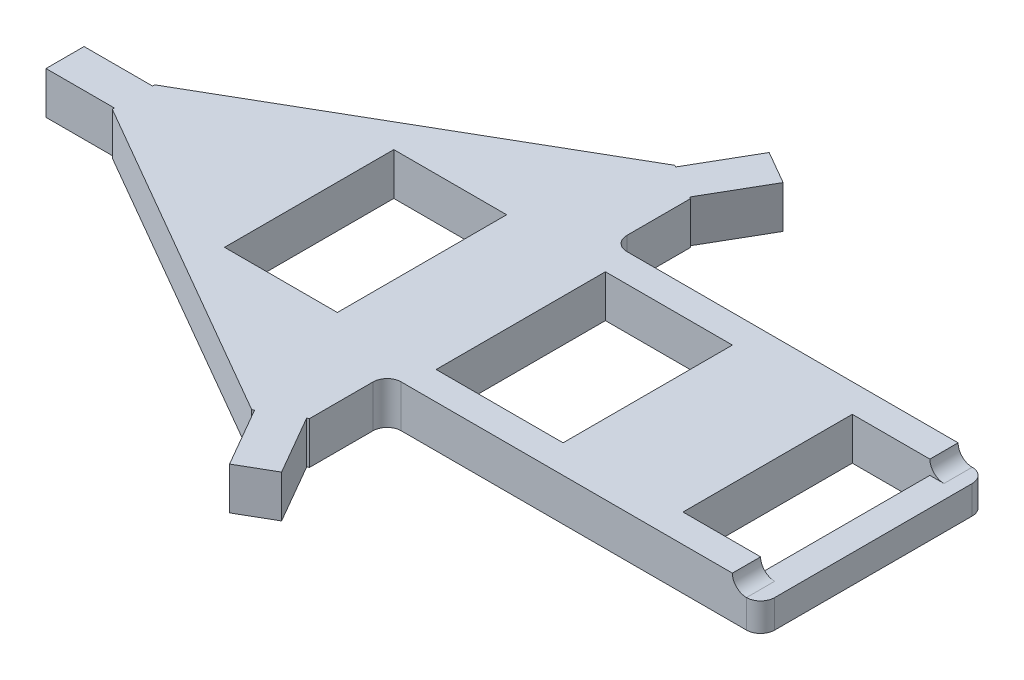
from build123d import *

# Parameters (mm, degrees)
SKETCH2_R                   = 88.9
BOSS_EXTRUDE1_DEPTH         = 3.175
SKETCH4_W                   = 15
SKETCH4_H                   = 17
SKETCH4_W_2                 = 21.412198496
SKETCH4_H_2                 = 63.5
CUT_EXTRUDE2_DEPTH          = 126.763669734
CIRPATTERN1_COUNT           = 3
CUT_EXTRUDE3_DEPTH          = 126.763669734
SKETCH8_R                   = 94.275983059
SKETCH8_R_2                 = 86.655983059
CUT_EXTRUDE_THIN1_DEPTH     = 126.763669734
SKETCH9_R                   = 3.175
CUT_EXTRUDE4_DEPTH          = 123.591188203
CIRPATTERN2_COUNT           = 3
SKETCH11_R                  = 1.5875
CUT_EXTRUDE6_DEPTH          = 123.591188203
CIRPATTERN3_COUNT           = 2
CIRPATTERN3_ANGLE           = 120
CIRPATTERN3_COPY_1_SKETCH_R = 1.5875
CIRPATTERN3_COPY_1_DEPTH    = 123.591188203
SKETCH12_R                  = 1.5875
CUT_EXTRUDE7_DEPTH          = 123.591188203
CIRPATTERN4_COUNT           = 2
CIRPATTERN4_ANGLE           = 120
CUT_EXTRUDE8_DEPTH          = 150
FILLET1_R                   = 22.86
BOSS_EXTRUDE2_DEPTH         = 3
SKETCH16_R                  = 86.655983059
CUT_EXTRUDE10_DEPTH         = 123.591188203
SKETCH17_W                  = 3
SKETCH17_H                  = 3
BOSS_EXTRUDE3_DEPTH         = 2
SKETCH18_R                  = 21.678393759
BOSS_EXTRUDE4_DEPTH         = 3
BOSS_EXTRUDE5_DEPTH         = 3
CUT_EXTRUDE11_DEPTH         = 50.498580331
CUT_EXTRUDE11_DEPTH_BACK    = 50.498580331
SKETCH21_W                  = 88.192317665
SKETCH21_H                  = 6
SKETCH23_W                  = 3
SKETCH23_H                  = 3
BOSS_EXTRUDE6_DEPTH         = 3
BOSS_EXTRUDE7_DEPTH         = 3
SKETCH27_W                  = 19.64601661
SKETCH27_H                  = 60.043759506
CUT_EXTRUDE12_DEPTH         = 3
BOSS_EXTRUDE8_DEPTH         = 3
CUT_EXTRUDE13_DEPTH         = 34.081573483
CUT_EXTRUDE13_DEPTH_BACK    = 3
CUT_EXTRUDE14_DEPTH         = 10
SKETCH31_W                  = 8
SKETCH31_H                  = 12
SKETCH31_W_2                = 26.473720558
SKETCH31_H_2                = 16
BOSS_EXTRUDE9_DEPTH         = 3
SKETCH32_W                  = 38.250446416
SKETCH32_H                  = 3
CUT_EXTRUDE15_DEPTH         = 62.626362233
SKETCH34_W                  = 2
SKETCH34_H                  = 16
CUT_EXTRUDE16_DEPTH         = 1
FILLET2_R                   = 1


with BuildPart() as part:
    # Sketch2 → Boss-Extrude1 (new body)
    with BuildSketch(Plane(origin=(0, 0, 0), x_dir=(1, 0, 0), z_dir=(0, 1, 0))):
        with Locations(Location((0, 0, 0), (0, 0, 270))):
            Circle(SKETCH2_R)
    extrude(amount=BOSS_EXTRUDE1_DEPTH)

    # Sketch4 → Cut-Extrude2 (cut, through all)
    with BuildSketch(Plane(origin=(0, 3.175, 0), x_dir=(1, 0, 0), z_dir=(0, 1, 0))):
        Polygon((23.51, 15.5), (16.51, 15.5), (16.51, -15.5), (23.51, -15.5), (23.51, -8.5), (23.51, 8.5), align=None)
        with Locations((73.13, 0)):
            Rectangle(SKETCH4_W, SKETCH4_H)
        with Locations((31.01, 0)):
            Rectangle(SKETCH4_W, SKETCH4_H)
        with Locations((91.336099248, 0)):
            Rectangle(SKETCH4_W_2, SKETCH4_H_2)
    cut_extrude2 = extrude(amount=-CUT_EXTRUDE2_DEPTH, mode=Mode.SUBTRACT)

    # CirPattern1: Cut-Extrude2 ×3 about axis
    cirpattern1_axis = Axis((0, 0, 0), (0, 1, 0))
    for i in range(1, CIRPATTERN1_COUNT):
        add(cut_extrude2.rotate(cirpattern1_axis, i * 360 / CIRPATTERN1_COUNT), mode=Mode.SUBTRACT)

    # Sketch6 → Cut-Extrude3 (cut, through all)
    with BuildSketch(Plane(origin=(0, 3.175, 0), x_dir=(1, 0, 0), z_dir=(0, 1, 0))):
        Polygon((-21.678393759, -6.548079416), (-21.678393759, 6.548079416), (5.168393759, 22.048079416), (16.51, 15.5), (16.51, -15.5), (5.168393759, -22.048079416), align=None)
    extrude(amount=-CUT_EXTRUDE3_DEPTH, mode=Mode.SUBTRACT)

    # Sketch8 → Cut-Extrude-Thin1 (cut, through all)
    with BuildSketch(Plane(origin=(0, 3.175, 0), x_dir=(1, 0, 0), z_dir=(0, 1, 0))):
        Circle(SKETCH8_R)
        Circle(SKETCH8_R_2, mode=Mode.SUBTRACT)
    extrude(amount=-CUT_EXTRUDE_THIN1_DEPTH, mode=Mode.SUBTRACT)

    # Sketch9 → Cut-Extrude4 (cut, through all)
    with BuildSketch(Plane(origin=(0, 3.175, 0), x_dir=(1, 0, 0), z_dir=(0, 1, 0))):
        with Locations(Location((65.549718535, 24.13, 0), (0, 0, 270))):
            Circle(SKETCH9_R)
        with Locations(Location((65.549718535, -24.13, 0), (0, 0, 90))):
            Circle(SKETCH9_R)
    cut_extrude4 = extrude(amount=-CUT_EXTRUDE4_DEPTH, mode=Mode.SUBTRACT)

    # CirPattern2: Cut-Extrude4 ×3 about axis
    cirpattern2_axis = Axis((0, 0, 0), (0, 1, 0))
    for i in range(1, CIRPATTERN2_COUNT):
        add(cut_extrude4.rotate(cirpattern2_axis, i * 360 / CIRPATTERN2_COUNT), mode=Mode.SUBTRACT)

    # Sketch11 → Cut-Extrude6 (cut, through all)
    with BuildSketch(Plane(origin=(0, 3.175, 0), x_dir=(1, 0, 0), z_dir=(0, 1, 0))):
        with Locations(Location((-74.764393759, 36.83, 0), (0, 0, 270))):
            Circle(SKETCH11_R)
        with Locations(Location((-62.064393759, 36.83, 0), (0, 0, 270))):
            Circle(SKETCH11_R)
        with Locations(Location((-74.764393759, 24.13, 0), (0, 0, 270))):
            Circle(SKETCH11_R)
    cut_extrude6 = extrude(amount=-CUT_EXTRUDE6_DEPTH, mode=Mode.SUBTRACT)

    # Mirror1: Cut-Extrude6 across plane
    add(cut_extrude6.mirror(Plane.XY), mode=Mode.SUBTRACT)

    # CirPattern3: Cut-Extrude6 ×2 about axis
    cirpattern3_axis = Axis((0, 0, 0), (0, 1, 0))
    for i in range(1, CIRPATTERN3_COUNT):
        add(cut_extrude6.rotate(cirpattern3_axis, i * CIRPATTERN3_ANGLE / (CIRPATTERN3_COUNT - 1)), mode=Mode.SUBTRACT)

    # CirPattern3 copy 1 sketch → CirPattern3 copy 1 (cut, through all)
    with BuildSketch(Plane(origin=(0, 3.175, 0), x_dir=(-0.5000000000000044, 0, -0.866025403784436), z_dir=(0, 1, 0))):
        with Locations((-74.764393759, -36.83)):
            Circle(CIRPATTERN3_COPY_1_SKETCH_R)
        with Locations((-62.064393759, -36.83)):
            Circle(CIRPATTERN3_COPY_1_SKETCH_R)
        with Locations((-74.764393759, -24.13)):
            Circle(CIRPATTERN3_COPY_1_SKETCH_R)
    extrude(amount=-CIRPATTERN3_COPY_1_DEPTH, mode=Mode.SUBTRACT)

    # Sketch12 → Cut-Extrude7 (cut, through all)
    with BuildSketch(Plane(origin=(0, 3.175, 0), x_dir=(1, 0, 0), z_dir=(0, 1, 0))):
        with Locations(Location((-33.108393759, 0, 0), (0, 0, 270))):
            Circle(SKETCH12_R)
        with BuildLine():
            ThreePointArc((-25.488393759, 5.3975), (-27.075893759, 3.81), (-25.488393759, 2.2225))
            Line((-25.488393759, 2.2225), (-25.488393759, 5.3975))
        make_face()
        with BuildLine():
            Line((-25.488393759, 5.3975), (-25.488393759, 2.2225))
            ThreePointArc((-25.488393759, 2.2225), (-24.365861744, 2.687467985), (-23.900893759, 3.81))
            ThreePointArc((-23.900893759, 3.81), (-24.365861744, 4.932532015), (-25.488393759, 5.3975))
        make_face()
        with BuildLine():
            ThreePointArc((-25.488393759, -2.2225), (-27.075893759, -3.81), (-25.488393759, -5.3975))
            Line((-25.488393759, -5.3975), (-25.488393759, -2.2225))
        make_face()
        with BuildLine():
            Line((-25.488393759, -2.2225), (-25.488393759, -5.3975))
            ThreePointArc((-25.488393759, -5.3975), (-24.365861744, -4.932532015), (-23.900893759, -3.81))
            ThreePointArc((-23.900893759, -3.81), (-24.365861744, -2.687467985), (-25.488393759, -2.2225))
        make_face()
    cut_extrude7 = extrude(amount=-CUT_EXTRUDE7_DEPTH, mode=Mode.SUBTRACT)

    # CirPattern4: Cut-Extrude7 ×2 about axis
    cirpattern4_axis = Axis((0, 0, 0), (0, 1, 0))
    for i in range(1, CIRPATTERN4_COUNT):
        add(cut_extrude7.rotate(cirpattern4_axis, i * CIRPATTERN4_ANGLE / (CIRPATTERN4_COUNT - 1)), mode=Mode.SUBTRACT)

    # Sketch10 → Cut-Extrude8 (cut)
    with BuildSketch(Plane(origin=(0, 3.175, 0), x_dir=(1, 0, 0), z_dir=(0, 1, 0))):
        Polygon((49.845863359, 15.215567884), (75.245863359, 59.209658396), (13.654136641, 94.769658396), (-11.745863359, 50.775567884), align=None)
    extrude(amount=-CUT_EXTRUDE8_DEPTH, mode=Mode.SUBTRACT)

    # Fillet1
    fillet1_edges = [part.edges().sort_by_distance(p)[0] for p in [
        (49.845863359, 1.5875, -15.215567884),
        (-11.745863359, 1.5875, -50.775567884),
    ]]
    fillet(fillet1_edges, radius=FILLET1_R)

    # Sketch16 → Cut-Extrude10 (cut, through all)
    with BuildSketch(Plane(origin=(0, 3.175, 0), x_dir=(1, 0, 0), z_dir=(0, 1, 0))):
        Circle(SKETCH16_R)
        Polygon((-21.678393759, -6.548079416), (5.168393759, -22.048079416), (16.51, -15.5), (16.51, 15.5), (5.168393759, 22.048079416), (-21.678393759, 6.548079416), align=None, mode=Mode.SUBTRACT)
    extrude(amount=-CUT_EXTRUDE10_DEPTH, mode=Mode.SUBTRACT)


with BuildPart() as body_2:
    # Sketch15 → Boss-Extrude2 (new body)
    with BuildSketch(Plane(origin=(0, 3.175, 0), x_dir=(1, 0, 0), z_dir=(0, 1, 0))):
        Polygon((5.168393759, -22.048079416), (16.51, -15.5), (16.51, 15.5), (5.168393759, 22.048079416), (-21.678393759, 6.548079416), (-21.678393759, -6.548079416), align=None)
    extrude(amount=BOSS_EXTRUDE2_DEPTH)

    # Sketch17 → Boss-Extrude3 (add)
    with BuildSketch(Plane.ZY.offset(21.678393759)):
        with Locations((0, 4.675)):
            Rectangle(SKETCH17_W, SKETCH17_H)
    extrude(amount=BOSS_EXTRUDE3_DEPTH)

    # Sketch18 → Boss-Extrude4 (add)
    with BuildSketch(Plane(origin=(0, 6.175, 0), x_dir=(1, 0, 0), z_dir=(0, 1, 0))):
        Circle(SKETCH18_R)
    extrude(amount=-BOSS_EXTRUDE4_DEPTH)

    # Sketch20 → Boss-Extrude5 (add)
    # profile 1 of 3: a face of its own
    with BuildSketch(Plane(origin=(0, 6.175, 0), x_dir=(1, 0, 0), z_dir=(0, 1, 0))):
        Polygon((12.138234985, -18.024039708), (12.138234985, 18.024039708), (9.540158774, 19.524039708), (-21.678393759, 1.5), (-23.678393759, 1.5), (-23.678393759, -1.5), (-21.678393759, -1.5), (9.540158774, -19.524039708), align=None)
        Polygon((9.138234985, -1.732050808), (9.138234985, -15.827887286), (-3.069117493, -8.779969047), align=None, mode=Mode.SUBTRACT)
        Polygon((-6.069117493, -7.047918239), (-18.27646997, 0), (-6.069117493, 7.047918239), align=None, mode=Mode.SUBTRACT)
        Polygon((-3.069117493, 5.315867431), (6.138234985, 0), (-3.069117493, -5.315867431), align=None, mode=Mode.SUBTRACT)
        Polygon((-3.069117493, 8.779969047), (9.138234985, 15.827887286), (9.138234985, 1.732050808), align=None, mode=Mode.SUBTRACT)
    # profile 2 of 3: a face of its own
    with BuildSketch(Plane(origin=(0, 6.175, 0), x_dir=(1, 0, 0), z_dir=(0, 1, 0))):
        Polygon((13.138234985, -19.756090516), (12.138234985, -18.024039708), (9.540158774, -19.524039708), (10.540158774, -21.256090516), align=None)
    # profile 3 of 3: a face of its own
    with BuildSketch(Plane(origin=(0, 6.175, 0), x_dir=(1, 0, 0), z_dir=(0, 1, 0))):
        Polygon((9.540158774, 19.524039708), (12.138234985, 18.024039708), (13.138234985, 19.756090516), (10.540158774, 21.256090516), align=None)
    extrude(amount=BOSS_EXTRUDE5_DEPTH)

    # Sketch21 → Cut-Extrude11 (cut, two sides: drawn at the far end of the back side and taken through both)
    with BuildSketch(Plane.ZY.offset(21.678393759).offset(-CUT_EXTRUDE11_DEPTH_BACK)):
        with Locations((-22.048079416, 3.175)):
            Rectangle(SKETCH21_W, SKETCH21_H)
    extrude(amount=CUT_EXTRUDE11_DEPTH + CUT_EXTRUDE11_DEPTH_BACK, mode=Mode.SUBTRACT)

    # Sketch23 → Boss-Extrude6 (add, through all)
    with BuildSketch(Plane(origin=(0, 9.175, 0), x_dir=(1, 0, 0), z_dir=(0, 1, 0))):
        Polygon((13.138234985, 19.756090516), (10.540158774, 21.256090516), (12.040158774, 23.854166727), (14.638234985, 22.354166727), align=None)
        with Locations((-25.178393759, 0)):
            Rectangle(SKETCH23_W, SKETCH23_H)
        Polygon((10.540158774, -21.256090516), (13.138234985, -19.756090516), (14.638234985, -22.354166727), (12.040158774, -23.854166727), align=None)
    extrude(amount=-BOSS_EXTRUDE6_DEPTH)

    # Sketch25 → Boss-Extrude7 (add)
    with BuildSketch(Plane(origin=(0, 9.175, 0), x_dir=(1, 0, 0), z_dir=(0, 1, 0))):
        Polygon((-21.678393759, -1.5), (9.540158774, -19.524039708), (12.040158774, -23.854166727), (14.638234985, -22.354166727), (12.138234985, -18.024039708), (12.138234985, 18.024039708), (14.638234985, 22.354166727), (12.040158774, 23.854166727), (9.540158774, 19.524039708), (-21.678393759, 1.5), (-26.678393759, 1.5), (-26.678393759, -1.5), align=None)
    extrude(amount=-BOSS_EXTRUDE7_DEPTH)

    # Sketch27 → Cut-Extrude12 (cut)
    with BuildSketch(Plane(origin=(0, 9.175, 0), x_dir=(1, 0, 0), z_dir=(0, 1, 0))):
        with Locations((11.527300449, -3.453437088)):
            Rectangle(SKETCH27_W, SKETCH27_H)
    extrude(amount=-CUT_EXTRUDE12_DEPTH, mode=Mode.SUBTRACT)

    # Sketch26 → Boss-Extrude8 (add)
    with BuildSketch(Plane(origin=(0, 9.175, 0), x_dir=(1, 0, 0), z_dir=(0, 1, 0))):
        Polygon((1.704292144, 15), (-21.678393759, 1.5), (-26.678393759, 1.5), (-26.678393759, -1.5), (-21.678393759, -1.5), (1.704292144, -15), (6.704292144, -17.886751346), (6.802368355, -17.830127019), (4.302368355, -13.5), (4.302368355, 13.5), (6.802368355, 17.830127019), (6.704292144, 17.886751346), align=None)
        Polygon((4.204292144, 19.330127019), (1.704292144, 15), (6.704292144, 17.886751346), align=None)
        Polygon((6.704292144, -17.886751346), (1.704292144, -15), (4.204292144, -19.330127019), align=None)
    extrude(amount=-BOSS_EXTRUDE8_DEPTH)

    # Sketch28 → Cut-Extrude13 (cut, two sides: drawn at the far end of the back side and taken through both)
    with BuildSketch(Plane(origin=(0, 9.175, 0), x_dir=(1, 0, 0), z_dir=(0, 1, 0)).offset(-CUT_EXTRUDE13_DEPTH_BACK)):
        Polygon((-9.987050808, 4.785898385), (-18.27646997, 0), (-9.987050808, 0), align=None)
        Polygon((-9.987050808, 0), (-18.27646997, 0), (-9.987050808, -4.785898385), align=None)
        Polygon((-6.987050808, -6.517949192), (1.302368355, -11.303847577), (1.302368355, -1.732050808), align=None)
        Polygon((1.302368355, 1.732050808), (1.302368355, 11.303847577), (-6.987050808, 6.517949192), align=None)
    extrude(amount=CUT_EXTRUDE13_DEPTH + CUT_EXTRUDE13_DEPTH_BACK, mode=Mode.SUBTRACT)

    # Sketch29 → Cut-Extrude14 (cut)
    with BuildSketch(Plane(origin=(0, 9.175, 0), x_dir=(1, 0, 0), z_dir=(0, 1, 0))):
        Polygon((4.302368355, 13.5), (6.802368355, 17.830127019), (4.204292144, 19.330127019), (1.704292144, 15), (1.834195954, 14.925), (4.259195954, 19.125223208), (6.597464544, 17.775223208), (4.172464544, 13.575), align=None)
        Polygon((-21.678393759, 1.35), (-21.678393759, 1.5), (-26.678393759, 1.5), (-26.678393759, -1.5), (-21.678393759, -1.5), (-21.678393759, -1.35), (-26.528393759, -1.35), (-26.528393759, 1.35), align=None)
        Polygon((1.704292144, -15), (4.204292144, -19.330127019), (6.802368355, -17.830127019), (4.302368355, -13.5), (4.172464544, -13.575), (6.597464544, -17.775223208), (4.259195954, -19.125223208), (1.834195954, -14.925), align=None)
    extrude(amount=-CUT_EXTRUDE14_DEPTH, mode=Mode.SUBTRACT)

    # Sketch31 → Boss-Extrude9 (add)
    # profile 1 of 2: a face of its own
    with BuildSketch(Plane(origin=(0, 9.175, 0), x_dir=(1, 0, 0), z_dir=(0, 1, 0))):
        Polygon((4.302368355, -8), (4.302368355, 8), (4.302368355, 13.5), (4.172464544, 13.575), (6.597464544, 17.775223208), (4.259195954, 19.125223208), (1.834195954, 14.925), (1.704292144, 15), (-21.678393759, 1.5), (-21.678393759, 1.35), (-26.528393759, 1.35), (-26.528393759, -1.35), (-21.678393759, -1.35), (-21.678393759, -1.5), (1.704292144, -15), (1.834195954, -14.925), (4.259195954, -19.125223208), (6.597464544, -17.775223208), (4.172464544, -13.575), (4.302368355, -13.5), align=None)
        with Locations((-5.223911087, 0)):
            Rectangle(SKETCH31_W, SKETCH31_H, mode=Mode.SUBTRACT)
    # profile 2 of 2: a face of its own
    with BuildSketch(Plane(origin=(0, 9.175, 0), x_dir=(1, 0, 0), z_dir=(0, 1, 0))):
        with Locations((17.539228634, 0)):
            Rectangle(SKETCH31_W_2, SKETCH31_H_2)
        Polygon((5.776088913, -6), (5.776088913, -5), (5.776088913, 5), (5.776088913, 6), (14.776088913, 6), (14.776088913, 5), (14.776088913, -5), (14.776088913, -6), align=None, mode=Mode.SUBTRACT)
        Polygon((28.776088913, -6), (23.276088913, -6), (23.276088913, -5), (23.276088913, 5), (23.276088913, 6), (28.776088913, 6), (28.776088913, 5), (28.776088913, -5), align=None, mode=Mode.SUBTRACT)
    extrude(amount=BOSS_EXTRUDE9_DEPTH)

    # Sketch32 → Cut-Extrude15 (cut, through all)
    with BuildSketch(Plane.ZY.offset(26.528393759)):
        with Locations((0, 7.675)):
            Rectangle(SKETCH32_W, SKETCH32_H)
    extrude(amount=-CUT_EXTRUDE15_DEPTH, mode=Mode.SUBTRACT)

    # Sketch34 → Cut-Extrude16 (cut)
    with BuildSketch(Plane(origin=(0, 12.175, 0), x_dir=(1, 0, 0), z_dir=(0, 1, 0))):
        with Locations((29.776088913, 0)):
            Rectangle(SKETCH34_W, SKETCH34_H)
    extrude(amount=-CUT_EXTRUDE16_DEPTH, mode=Mode.SUBTRACT)

    # Fillet2
    fillet2_edges = [body_2.edges().sort_by_distance(p)[0] for p in [
        (4.302368355, 10.675, -8),
        (4.302368355, 10.675, 8),
        (30.776088913, 10.175, -8),
        (28.776088913, 11.175, -7),
        (30.776088913, 10.175, 8),
        (28.776088913, 11.175, 7),
    ]]
    fillet(fillet2_edges, radius=FILLET2_R - 0.0001)  # a hair under: the kernel refuses the full size


solid = body_2.part
